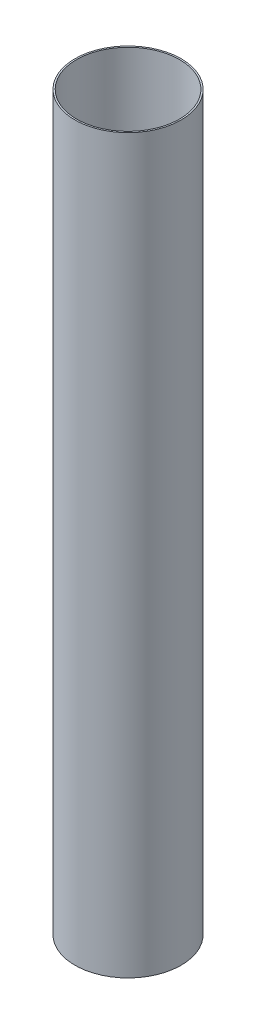
from build123d import *

# Parameters (mm, degrees)
SKETCH1_R           = 65.405
SKETCH1_R_2         = 63.5
BOSS_EXTRUDE1_DEPTH = 450.85


with BuildPart() as part:
    # Sketch1 → Boss-Extrude1 (new, symmetric)
    with BuildSketch(Plane(origin=(0, 0, 0), x_dir=(1, 0, 0), z_dir=(0, 1, 0))):
        Circle(SKETCH1_R)
        Circle(SKETCH1_R_2, mode=Mode.SUBTRACT)
    extrude(amount=BOSS_EXTRUDE1_DEPTH, both=True)


solid = part.part
